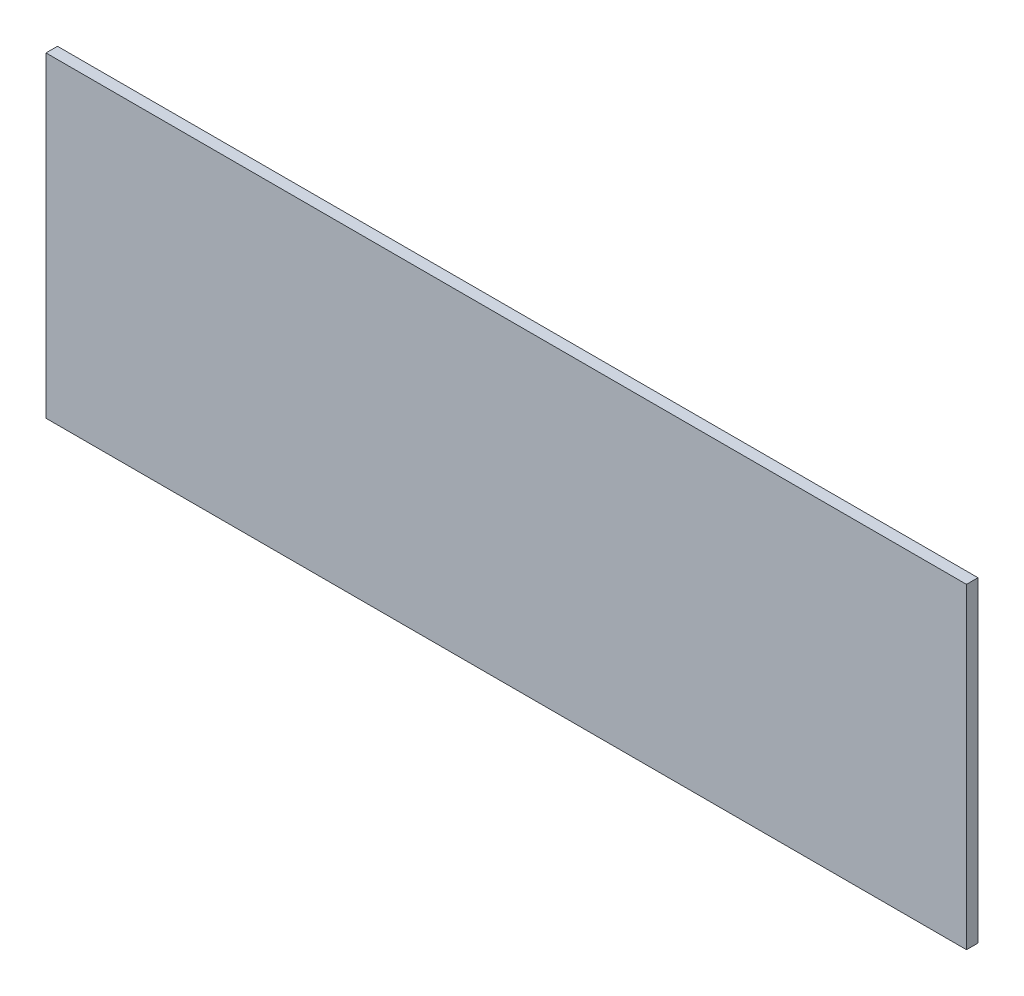
from build123d import *

# Parameters (mm, degrees)
SKETCH1_W           = 80
SKETCH1_H           = 27.5
BOSS_EXTRUDE1_DEPTH = 1


with BuildPart() as part:
    # Sketch1 → Boss-Extrude1 (new body)
    with BuildSketch(Plane.XY):
        Rectangle(SKETCH1_W, SKETCH1_H)
    extrude(amount=BOSS_EXTRUDE1_DEPTH)


solid = part.part
